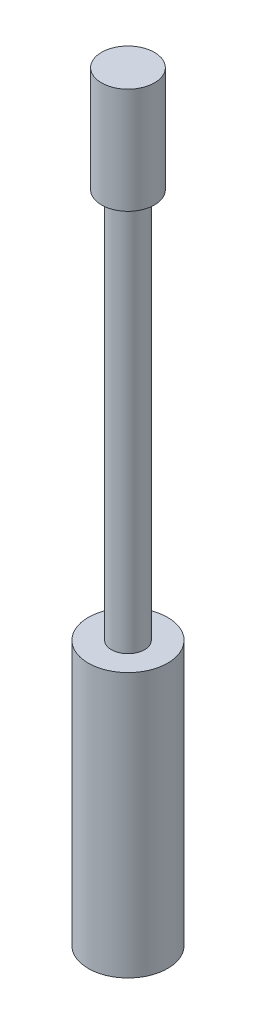
from build123d import *

# Parameters (mm, degrees)
SKETCH1_R           = 6
BOSS_EXTRUDE1_DEPTH = 40
SKETCH2_R           = 2.5
BOSS_EXTRUDE2_DEPTH = 59
SKETCH3_R           = 4
BOSS_EXTRUDE3_DEPTH = 16


with BuildPart() as part:
    # Sketch1 → Boss-Extrude1 (new body)
    with BuildSketch(Plane(origin=(0, 0, 0), x_dir=(1, 0, 0), z_dir=(0, 1, 0))):
        Circle(SKETCH1_R)
    extrude(amount=BOSS_EXTRUDE1_DEPTH)

    # Sketch2 → Boss-Extrude2 (add)
    with BuildSketch(Plane(origin=(0, 40, 0), x_dir=(1, 0, 0), z_dir=(0, 1, 0))):
        Circle(SKETCH2_R)
    extrude(amount=BOSS_EXTRUDE2_DEPTH)

    # Sketch3 → Boss-Extrude3 (add)
    with BuildSketch(Plane(origin=(0, 99, 0), x_dir=(1, 0, 0), z_dir=(0, 1, 0))):
        Circle(SKETCH3_R)
    extrude(amount=BOSS_EXTRUDE3_DEPTH)


solid = part.part
